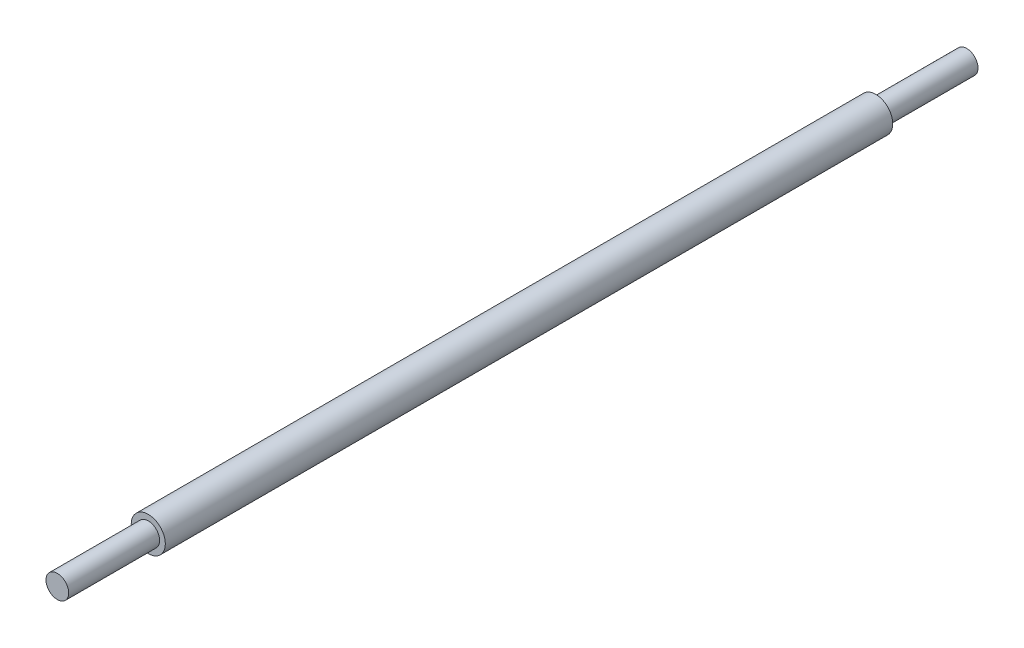
from build123d import *

# Parameters (mm, degrees)
SKETCH1_R           = 2.38125
BOSS_EXTRUDE1_DEPTH = 127
SKETCH2_R           = 2.38125
SKETCH2_R_2         = 1.5875
CUT_EXTRUDE1_DEPTH  = 12.7
CUT_EXTRUDE2_START  = -12.7
SKETCH3_R           = 2.38125
SKETCH3_R_2         = 1.5875
CUT_EXTRUDE2_DEPTH  = 12.7


with BuildPart() as part:
    # Sketch1 → Boss-Extrude1 (new body)
    with BuildSketch(Plane.XY):
        Circle(SKETCH1_R)
    extrude(amount=BOSS_EXTRUDE1_DEPTH)

    # Sketch2 → Cut-Extrude1 (cut)
    with BuildSketch(Plane(origin=(0, 0, 0), x_dir=(-1, 0, 0), z_dir=(0, 0, -1))):
        Circle(SKETCH2_R)
        Circle(SKETCH2_R_2, mode=Mode.SUBTRACT)
    extrude(amount=-CUT_EXTRUDE1_DEPTH, mode=Mode.SUBTRACT)

    # Sketch3 → Cut-Extrude2 (cut)
    with BuildSketch(Plane.XY.offset(127).offset(CUT_EXTRUDE2_START)):
        Circle(SKETCH3_R)
        Circle(SKETCH3_R_2, mode=Mode.SUBTRACT)
    extrude(amount=CUT_EXTRUDE2_DEPTH, mode=Mode.SUBTRACT)


solid = part.part
